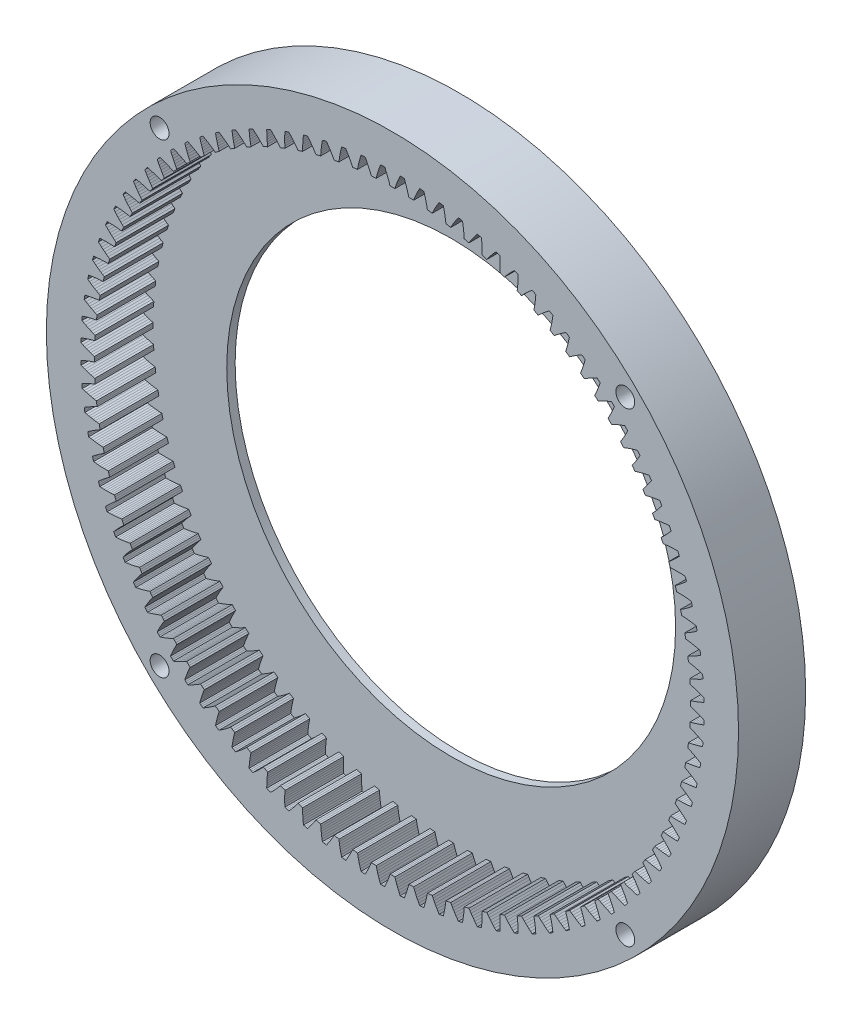
from build123d import *

# Parameters (mm, degrees)
INTERNAL_RING_TEETH_START = 30
SKETCH_1_R                = 82.5
INTERNAL_RING_TEETH_DEPTH = 14
RING_BACK_FLANGE_START    = 28
SKETCH_2_R                = 82.5
SKETCH_2_R_2              = 53.5
RING_BACK_FLANGE_DEPTH    = 2
SKETCH_3_R                = 2.25
THROUGH_HOLES_DEPTH       = 100


with BuildPart() as part:
    # Эскиз1 → Internal_ring_teeth (new body)
    with BuildSketch(Plane.XY.offset(INTERNAL_RING_TEETH_START)):
        Circle(SKETCH_1_R)
        Polygon((74.28969993, -1.840690248), (73.828419026, -1.630814793), (73.366414023, -1.430422241), (72.903744658, -1.239788746), (72.440470557, -1.059234916), (71.97665124, -0.889138112), (71.512346107, -0.729949937), (71.047614439, -0.582222073), (71.049734936, -0.194075955), (71.049734936, 0.194075955), (71.047614439, 0.582222073), (71.512346107, 0.729949937), (71.97665124, 0.889138112), (72.440470557, 1.059234916), (72.903744658, 1.239788746), (73.366414023, 1.430422241), (73.828419026, 1.630814793), (74.28969993, 1.840690248), (74.280818469, 2.169715144), (74.270479783, 2.498697476), (74.258684074, 2.827630788), (73.785135214, 3.008128035), (73.31145912, 3.179115623), (72.83773275, 3.340321696), (72.364035747, 3.491430024), (71.890451204, 3.632067724), (71.417066763, 3.761787817), (70.943976228, 3.880043431), (70.921720644, 4.267556779), (70.897348384, 4.65494276), (70.870860175, 5.042189813), (71.325398891, 5.218806913), (71.778792316, 5.406834927), (72.231015926, 5.605719539), (72.682038791, 5.815006309), (73.131825208, 6.034314882), (73.580335797, 6.263321539), (74.02752828, 6.50174692), (73.998004701, 6.82956489), (73.967029444, 7.157248878), (73.934603117, 7.484792457), (73.450655182, 7.635199155), (72.96717738, 7.77610697), (72.484263588, 7.907249415), (72.002013147, 8.028315884), (71.520532401, 8.138939448), (71.039936884, 8.238679513), (70.560354553, 8.326996177), (70.513810722, 8.712347415), (70.465162388, 9.097438632), (70.414411003, 9.482258333), (70.856962912, 9.687067641), (71.297655292, 9.903193434), (71.736498473, 10.130080948), (72.173490123, 10.367274699), (72.60861849, 10.614392839), (73.041864599, 10.871109816), (73.473203796, 11.137144168), (73.423154614, 11.462461463), (73.371665032, 11.787553889), (73.31873606, 12.11241507), (72.82629897, 12.232137632), (72.334927527, 12.342409575), (71.844732153, 12.442970833), (71.355831496, 12.533517649), (70.868354732, 12.613690497), (70.382444829, 12.683056905), (69.898263395, 12.741086072), (69.827615003, 13.122754397), (69.754882588, 13.50403107), (69.680068321, 13.884904711), (70.108886871, 14.11709794), (70.535138995, 14.360468561), (70.958869834, 14.614463556), (71.380105662, 14.878628191), (71.798858727, 15.152580637), (72.215130531, 15.43599479), (72.628914143, 15.728588196), (72.55853688, 16.050120937), (72.486736178, 16.37133881), (72.413513447, 16.692235514), (71.914530628, 16.78080145), (71.417204761, 16.860002329), (70.921662382, 16.92958553), (70.428040978, 16.989255346), (69.936492042, 17.038661072), (69.447185419, 17.077380066), (68.960315725, 17.104892722), (68.865841589, 17.481371862), (68.769312135, 17.857329266), (68.670730242, 18.232753714), (69.084123084, 18.491414502), (69.494252729, 18.761069479), (69.901198954, 19.041169552), (70.305016535, 19.331262536), (70.70574167, 19.630968121), (71.103396334, 19.939960944), (71.497991347, 20.257958672), (71.40756375, 20.574437917), (71.315735293, 20.890513537), (71.22250778, 21.206179331), (70.718948488, 21.263239111), (70.217630916, 21.311056356), (69.718697211, 21.349386887), (69.222303157, 21.377944214), (68.72862197, 21.396387836), (68.237849696, 21.40430661), (67.750213194, 21.401194175), (67.632286161, 21.770998339), (67.512340624, 22.140152743), (67.390380164, 22.508646368), (67.786715824, 22.792753899), (68.179104396, 23.087629027), (68.567659977, 23.392728752), (68.952465627, 23.707605219), (69.333581352, 24.031881143), (69.711049517, 24.365233182), (70.084898644, 24.70738024), (69.974777588, 25.01755699), (69.863283782, 25.32724295), (69.750419413, 25.636432045), (69.244270967, 25.661760482), (68.74094016, 25.67800538), (68.240584193, 25.684931967), (67.743376531, 25.682264102), (67.249511426, 25.669672832), (66.759210355, 25.646760134), (66.272731524, 25.613034892), (66.131816997, 25.974704632), (65.988928748, 26.335599151), (65.844071044, 26.695707678), (66.221785366, 27.00414071), (66.594884286, 27.323072251), (66.963515771, 27.651967538), (67.327790838, 27.990384815), (67.687793065, 28.337951309), (68.043585035, 28.694346976), (68.395212864, 29.059293066), (68.265832948, 29.361943194), (68.135113807, 29.664017306), (68.003058006, 29.965509475), (67.496317943, 29.959006608), (66.992960319, 29.943615047), (66.493156766, 29.919110356), (65.997097746, 29.885227828), (65.504997783, 29.841651357), (65.01710291, 29.787997613), (64.533701659, 29.723792661), (64.370355764, 30.075900633), (64.205088718, 30.427110981), (64.037905456, 30.777413225), (64.395507775, 31.108954514), (64.747844592, 31.450683792), (65.095097162, 31.802076641), (65.437404018, 32.16269915), (65.774871982, 32.532184528), (66.107583608, 32.910217292), (66.435602426, 33.296522138), (66.287474253, 33.590451223), (66.138045666, 33.883721338), (65.987319597, 34.176326729), (65.481987788, 34.138018222), (64.98058987, 34.091050946), (64.483311227, 34.035211684), (63.990358567, 33.970248212), (63.501965841, 33.895858517), (63.018402663, 33.811675474), (62.539986757, 33.7172442), (62.354854144, 34.058400794), (62.167860536, 34.398540905), (61.979011511, 34.737654384), (62.315090535, 35.090995487), (62.645274736, 35.454173852), (62.969777943, 35.826677477), (63.28876566, 36.208082005), (63.602367529, 36.598028077), (63.910685751, 36.996206016), (64.213801017, 37.402345049), (64.047509181, 37.686393088), (63.879960874, 37.969701802), (63.711159384, 38.252265635), (63.209230143, 38.182302674), (62.711770719, 38.103945042), (62.218979518, 38.016991581), (61.731078678, 37.921203546), (61.248320651, 37.816294209), (60.770997571, 37.701914099), (60.299455098, 37.577629181), (60.093266403, 37.906488007), (59.885284209, 38.234215504), (59.675514724, 38.560801891), (59.9887441, 38.934548332), (60.295472601, 39.317742485), (60.595945778, 39.709886785), (60.890355458, 40.110568102), (61.178853589, 40.519435929), (61.461561616, 40.936187616), (61.738577072, 41.360557992), (61.554777851, 41.633603975), (61.369771061, 41.9058332), (61.183560332, 42.177240324), (60.687014544, 42.075899022), (60.195456859, 41.966460274), (59.709097923, 41.848735781), (59.228174424, 41.722501215), (58.752956321, 41.587486265), (58.283757116, 41.443360494), (57.820949039, 41.289712426), (57.594517994, 41.604975629), (57.366368025, 41.918997121), (57.136505943, 42.231767529), (57.4256495, 42.624444303), (57.707711782, 43.026141951), (57.982969099, 43.436379311), (58.25163884, 43.854756112), (58.513894663, 44.280932079), (58.769876775, 44.714612785), (59.019699168, 45.155539708), (58.819117934, 45.416506049), (58.617382799, 45.676581419), (58.414497719, 45.935760715), (57.925295024, 45.803441018), (57.441579032, 45.663353061), (56.963571796, 45.51532214), (56.491523624, 45.359139232), (56.025720914, 45.194551512), (55.566497299, 45.021248878), (55.114250109, 44.83884404), (54.868470334, 45.13926742), (54.621052995, 45.438343607), (54.372005476, 45.736063675), (54.635922096, 46.146121065), (54.892204988, 46.564736892), (55.141160131, 46.991448292), (55.383029617, 47.425869435), (55.618008128, 47.86767162), (55.846254081, 48.316569807), (56.067897476, 48.772313138), (55.851325831, 49.020169922), (55.633658506, 49.267065038), (55.414899771, 49.512993644), (54.934970829, 49.350217759), (54.461005535, 49.180033454), (53.993236475, 49.002280316), (53.531926588, 48.81676545), (53.077377582, 48.623254512), (52.629941902, 48.421458961), (52.190040414, 48.211017222), (51.925881889, 48.495415145), (51.660173622, 48.77836571), (51.392923544, 49.059860473), (51.630571668, 49.485680169), (51.860063739, 49.91956209), (52.081734196, 50.361063495), (52.295848879, 50.809814517), (52.502622724, 51.26549933), (52.702231735, 51.7278434), (52.894821407, 52.196604531), (52.66311406, 52.43037358), (52.43037358, 52.66311406), (52.196604531, 52.894821407), (51.7278434, 52.702231735), (51.26549933, 52.502622724), (50.809814517, 52.295848879), (50.361063495, 52.081734196), (49.91956209, 51.860063739), (49.485680169, 51.630571668), (49.059860473, 51.392923544), (48.77836571, 51.660173622), (48.495415145, 51.925881889), (48.211017222, 52.190040414), (48.421458961, 52.629941902), (48.623254512, 53.077377582), (48.81676545, 53.531926588), (49.002280316, 53.993236475), (49.180033454, 54.461005535), (49.350217759, 54.934970829), (49.512993644, 55.414899771), (49.267065038, 55.633658506), (49.020169922, 55.851325831), (48.772313138, 56.067897476), (48.316569807, 55.846254081), (47.86767162, 55.618008128), (47.425869435, 55.383029617), (46.991448292, 55.141160131), (46.564736892, 54.892204988), (46.146121065, 54.635922096), (45.736063675, 54.372005476), (45.438343607, 54.621052995), (45.13926742, 54.868470334), (44.83884404, 55.114250109), (45.021248878, 55.566497299), (45.194551512, 56.025720914), (45.359139232, 56.491523624), (45.51532214, 56.963571796), (45.663353061, 57.441579032), (45.803441018, 57.925295024), (45.935760715, 58.414497719), (45.676581419, 58.617382799), (45.416506049, 58.819117934), (45.155539708, 59.019699168), (44.714612785, 58.769876775), (44.280932079, 58.513894663), (43.854756112, 58.25163884), (43.436379311, 57.982969099), (43.026141951, 57.707711782), (42.624444303, 57.4256495), (42.231767529, 57.136505943), (41.918997121, 57.366368025), (41.604975629, 57.594517994), (41.289712426, 57.820949039), (41.443360494, 58.283757116), (41.587486265, 58.752956321), (41.722501215, 59.228174424), (41.848735781, 59.709097923), (41.966460274, 60.195456859), (42.075899022, 60.687014544), (42.177240324, 61.183560332), (41.9058332, 61.369771061), (41.633603975, 61.554777851), (41.360557992, 61.738577072), (40.936187616, 61.461561616), (40.519435929, 61.178853589), (40.110568102, 60.890355458), (39.709886785, 60.595945778), (39.317742485, 60.295472601), (38.934548332, 59.9887441), (38.560801891, 59.675514724), (38.234215504, 59.885284209), (37.906488007, 60.093266403), (37.577629181, 60.299455098), (37.701914099, 60.770997571), (37.816294209, 61.248320651), (37.921203546, 61.731078678), (38.016991581, 62.218979518), (38.103945042, 62.711770719), (38.182302674, 63.209230143), (38.252265635, 63.711159384), (37.969701802, 63.879960874), (37.686393088, 64.047509181), (37.402345049, 64.213801017), (36.996206016, 63.910685751), (36.598028077, 63.602367529), (36.208082005, 63.28876566), (35.826677477, 62.969777943), (35.454173852, 62.645274736), (35.090995487, 62.315090535), (34.737654384, 61.979011511), (34.398540905, 62.167860536), (34.058400794, 62.354854144), (33.7172442, 62.539986757), (33.811675474, 63.018402663), (33.895858517, 63.501965841), (33.970248212, 63.990358567), (34.035211684, 64.483311227), (34.091050946, 64.98058987), (34.138018222, 65.481987788), (34.176326729, 65.987319597), (33.883721338, 66.138045666), (33.590451223, 66.287474253), (33.296522138, 66.435602426), (32.910217292, 66.107583608), (32.532184528, 65.774871982), (32.16269915, 65.437404018), (31.802076641, 65.095097162), (31.450683792, 64.747844592), (31.108954514, 64.395507775), (30.777413225, 64.037905456), (30.427110981, 64.205088718), (30.075900633, 64.370355764), (29.723792661, 64.533701659), (29.787997613, 65.01710291), (29.841651357, 65.504997783), (29.885227828, 65.997097746), (29.919110356, 66.493156766), (29.943615047, 66.992960319), (29.959006608, 67.496317943), (29.965509475, 68.003058006), (29.664017306, 68.135113807), (29.361943194, 68.265832948), (29.059293066, 68.395212864), (28.694346976, 68.043585035), (28.337951309, 67.687793065), (27.990384815, 67.327790838), (27.651967538, 66.963515771), (27.323072251, 66.594884286), (27.00414071, 66.221785366), (26.695707678, 65.844071044), (26.335599151, 65.988928748), (25.974704632, 66.131816997), (25.613034892, 66.272731524), (25.646760134, 66.759210355), (25.669672832, 67.249511426), (25.682264102, 67.743376531), (25.684931967, 68.240584193), (25.67800538, 68.74094016), (25.661760482, 69.244270967), (25.636432045, 69.750419413), (25.32724295, 69.863283782), (25.01755699, 69.974777588), (24.70738024, 70.084898644), (24.365233182, 69.711049517), (24.031881143, 69.333581352), (23.707605219, 68.952465627), (23.392728752, 68.567659977), (23.087629027, 68.179104396), (22.792753899, 67.786715824), (22.508646368, 67.390380164), (22.140152743, 67.512340624), (21.770998339, 67.632286161), (21.401194175, 67.750213194), (21.40430661, 68.237849696), (21.396387836, 68.72862197), (21.377944214, 69.222303157), (21.349386887, 69.718697211), (21.311056356, 70.217630916), (21.263239111, 70.718948488), (21.206179331, 71.22250778), (20.890513537, 71.315735293), (20.574437917, 71.40756375), (20.257958672, 71.497991347), (19.939960944, 71.103396334), (19.630968121, 70.70574167), (19.331262536, 70.305016535), (19.041169552, 69.901198954), (18.761069479, 69.494252729), (18.491414502, 69.084123084), (18.232753714, 68.670730242), (17.857329266, 68.769312135), (17.481371862, 68.865841589), (17.104892722, 68.960315725), (17.077380066, 69.447185419), (17.038661072, 69.936492042), (16.989255346, 70.428040978), (16.92958553, 70.921662382), (16.860002329, 71.417204761), (16.78080145, 71.914530628), (16.692235514, 72.413513447), (16.37133881, 72.486736178), (16.050120937, 72.55853688), (15.728588196, 72.628914143), (15.43599479, 72.215130531), (15.152580637, 71.798858727), (14.878628191, 71.380105662), (14.614463556, 70.958869834), (14.360468561, 70.535138995), (14.11709794, 70.108886871), (13.884904711, 69.680068321), (13.50403107, 69.754882588), (13.122754397, 69.827615003), (12.741086072, 69.898263395), (12.683056905, 70.382444829), (12.613690497, 70.868354732), (12.533517649, 71.355831496), (12.442970833, 71.844732153), (12.342409575, 72.334927527), (12.232137632, 72.82629897), (12.11241507, 73.31873606), (11.787553889, 73.371665032), (11.462461463, 73.423154614), (11.137144168, 73.473203796), (10.871109816, 73.041864599), (10.614392839, 72.60861849), (10.367274699, 72.173490123), (10.130080948, 71.736498473), (9.903193434, 71.297655292), (9.687067641, 70.856962912), (9.482258333, 70.414411003), (9.097438632, 70.465162388), (8.712347415, 70.513810722), (8.326996177, 70.560354553), (8.238679513, 71.039936884), (8.138939448, 71.520532401), (8.028315884, 72.002013147), (7.907249415, 72.484263588), (7.77610697, 72.96717738), (7.635199155, 73.450655182), (7.484792457, 73.934603117), (7.157248878, 73.967029444), (6.82956489, 73.998004701), (6.50174692, 74.02752828), (6.263321539, 73.580335797), (6.034314882, 73.131825208), (5.815006309, 72.682038791), (5.605719539, 72.231015926), (5.406834927, 71.778792316), (5.218806913, 71.325398891), (5.042189813, 70.870860175), (4.65494276, 70.897348384), (4.267556779, 70.921720644), (3.880043431, 70.943976228), (3.761787817, 71.417066763), (3.632067724, 71.890451204), (3.491430024, 72.364035747), (3.340321696, 72.83773275), (3.179115623, 73.31145912), (3.008128035, 73.785135214), (2.827630788, 74.258684074), (2.498697476, 74.270479783), (2.169715144, 74.280818469), (1.840690248, 74.28969993), (1.630814793, 73.828419026), (1.430422241, 73.366414023), (1.239788746, 72.903744658), (1.059234916, 72.440470557), (0.889138112, 71.97665124), (0.729949937, 71.512346107), (0.582222073, 71.047614439), (0.194075955, 71.049734936), (-0.194075955, 71.049734936), (-0.582222073, 71.047614439), (-0.729949937, 71.512346107), (-0.889138112, 71.97665124), (-1.059234916, 72.440470557), (-1.239788746, 72.903744658), (-1.430422241, 73.366414023), (-1.630814793, 73.828419026), (-1.840690248, 74.28969993), (-2.169715144, 74.280818469), (-2.498697476, 74.270479783), (-2.827630788, 74.258684074), (-3.008128035, 73.785135214), (-3.179115623, 73.31145912), (-3.340321696, 72.83773275), (-3.491430024, 72.364035747), (-3.632067724, 71.890451204), (-3.761787817, 71.417066763), (-3.880043431, 70.943976228), (-4.267556779, 70.921720644), (-4.65494276, 70.897348384), (-5.042189813, 70.870860175), (-5.218806913, 71.325398891), (-5.406834927, 71.778792316), (-5.605719539, 72.231015926), (-5.815006309, 72.682038791), (-6.034314882, 73.131825208), (-6.263321539, 73.580335797), (-6.50174692, 74.02752828), (-6.82956489, 73.998004701), (-7.157248878, 73.967029444), (-7.484792457, 73.934603117), (-7.635199155, 73.450655182), (-7.77610697, 72.96717738), (-7.907249415, 72.484263588), (-8.028315884, 72.002013147), (-8.138939448, 71.520532401), (-8.238679513, 71.039936884), (-8.326996177, 70.560354553), (-8.712347415, 70.513810722), (-9.097438632, 70.465162388), (-9.482258333, 70.414411003), (-9.687067641, 70.856962912), (-9.903193434, 71.297655292), (-10.130080948, 71.736498473), (-10.367274699, 72.173490123), (-10.614392839, 72.60861849), (-10.871109816, 73.041864599), (-11.137144168, 73.473203796), (-11.462461463, 73.423154614), (-11.787553889, 73.371665032), (-12.11241507, 73.31873606), (-12.232137632, 72.82629897), (-12.342409575, 72.334927527), (-12.442970833, 71.844732153), (-12.533517649, 71.355831496), (-12.613690497, 70.868354732), (-12.683056905, 70.382444829), (-12.741086072, 69.898263395), (-13.122754397, 69.827615003), (-13.50403107, 69.754882588), (-13.884904711, 69.680068321), (-14.11709794, 70.108886871), (-14.360468561, 70.535138995), (-14.614463556, 70.958869834), (-14.878628191, 71.380105662), (-15.152580637, 71.798858727), (-15.43599479, 72.215130531), (-15.728588196, 72.628914143), (-16.050120937, 72.55853688), (-16.37133881, 72.486736178), (-16.692235514, 72.413513447), (-16.78080145, 71.914530628), (-16.860002329, 71.417204761), (-16.92958553, 70.921662382), (-16.989255346, 70.428040978), (-17.038661072, 69.936492042), (-17.077380066, 69.447185419), (-17.104892722, 68.960315725), (-17.481371862, 68.865841589), (-17.857329266, 68.769312135), (-18.232753714, 68.670730242), (-18.491414502, 69.084123084), (-18.761069479, 69.494252729), (-19.041169552, 69.901198954), (-19.331262536, 70.305016535), (-19.630968121, 70.70574167), (-19.939960944, 71.103396334), (-20.257958672, 71.497991347), (-20.574437917, 71.40756375), (-20.890513537, 71.315735293), (-21.206179331, 71.22250778), (-21.263239111, 70.718948488), (-21.311056356, 70.217630916), (-21.349386887, 69.718697211), (-21.377944214, 69.222303157), (-21.396387836, 68.72862197), (-21.40430661, 68.237849696), (-21.401194175, 67.750213194), (-21.770998339, 67.632286161), (-22.140152743, 67.512340624), (-22.508646368, 67.390380164), (-22.792753899, 67.786715824), (-23.087629027, 68.179104396), (-23.392728752, 68.567659977), (-23.707605219, 68.952465627), (-24.031881143, 69.333581352), (-24.365233182, 69.711049517), (-24.70738024, 70.084898644), (-25.01755699, 69.974777588), (-25.32724295, 69.863283782), (-25.636432045, 69.750419413), (-25.661760482, 69.244270967), (-25.67800538, 68.74094016), (-25.684931967, 68.240584193), (-25.682264102, 67.743376531), (-25.669672832, 67.249511426), (-25.646760134, 66.759210355), (-25.613034892, 66.272731524), (-25.974704632, 66.131816997), (-26.335599151, 65.988928748), (-26.695707678, 65.844071044), (-27.00414071, 66.221785366), (-27.323072251, 66.594884286), (-27.651967538, 66.963515771), (-27.990384815, 67.327790838), (-28.337951309, 67.687793065), (-28.694346976, 68.043585035), (-29.059293066, 68.395212864), (-29.361943194, 68.265832948), (-29.664017306, 68.135113807), (-29.965509475, 68.003058006), (-29.959006608, 67.496317943), (-29.943615047, 66.992960319), (-29.919110356, 66.493156766), (-29.885227828, 65.997097746), (-29.841651357, 65.504997783), (-29.787997613, 65.01710291), (-29.723792661, 64.533701659), (-30.075900633, 64.370355764), (-30.427110981, 64.205088718), (-30.777413225, 64.037905456), (-31.108954514, 64.395507775), (-31.450683792, 64.747844592), (-31.802076641, 65.095097162), (-32.16269915, 65.437404018), (-32.532184528, 65.774871982), (-32.910217292, 66.107583608), (-33.296522138, 66.435602426), (-33.590451223, 66.287474253), (-33.883721338, 66.138045666), (-34.176326729, 65.987319597), (-34.138018222, 65.481987788), (-34.091050946, 64.98058987), (-34.035211684, 64.483311227), (-33.970248212, 63.990358567), (-33.895858517, 63.501965841), (-33.811675474, 63.018402663), (-33.7172442, 62.539986757), (-34.058400794, 62.354854144), (-34.398540905, 62.167860536), (-34.737654384, 61.979011511), (-35.090995487, 62.315090535), (-35.454173852, 62.645274736), (-35.826677477, 62.969777943), (-36.208082005, 63.28876566), (-36.598028077, 63.602367529), (-36.996206016, 63.910685751), (-37.402345049, 64.213801017), (-37.686393088, 64.047509181), (-37.969701802, 63.879960874), (-38.252265635, 63.711159384), (-38.182302674, 63.209230143), (-38.103945042, 62.711770719), (-38.016991581, 62.218979518), (-37.921203546, 61.731078678), (-37.816294209, 61.248320651), (-37.701914099, 60.770997571), (-37.577629181, 60.299455098), (-37.906488007, 60.093266403), (-38.234215504, 59.885284209), (-38.560801891, 59.675514724), (-38.934548332, 59.9887441), (-39.317742485, 60.295472601), (-39.709886785, 60.595945778), (-40.110568102, 60.890355458), (-40.519435929, 61.178853589), (-40.936187616, 61.461561616), (-41.360557992, 61.738577072), (-41.633603975, 61.554777851), (-41.9058332, 61.369771061), (-42.177240324, 61.183560332), (-42.075899022, 60.687014544), (-41.966460274, 60.195456859), (-41.848735781, 59.709097923), (-41.722501215, 59.228174424), (-41.587486265, 58.752956321), (-41.443360494, 58.283757116), (-41.289712426, 57.820949039), (-41.604975629, 57.594517994), (-41.918997121, 57.366368025), (-42.231767529, 57.136505943), (-42.624444303, 57.4256495), (-43.026141951, 57.707711782), (-43.436379311, 57.982969099), (-43.854756112, 58.25163884), (-44.280932079, 58.513894663), (-44.714612785, 58.769876775), (-45.155539708, 59.019699168), (-45.416506049, 58.819117934), (-45.676581419, 58.617382799), (-45.935760715, 58.414497719), (-45.803441018, 57.925295024), (-45.663353061, 57.441579032), (-45.51532214, 56.963571796), (-45.359139232, 56.491523624), (-45.194551512, 56.025720914), (-45.021248878, 55.566497299), (-44.83884404, 55.114250109), (-45.13926742, 54.868470334), (-45.438343607, 54.621052995), (-45.736063675, 54.372005476), (-46.146121065, 54.635922096), (-46.564736892, 54.892204988), (-46.991448292, 55.141160131), (-47.425869435, 55.383029617), (-47.86767162, 55.618008128), (-48.316569807, 55.846254081), (-48.772313138, 56.067897476), (-49.020169922, 55.851325831), (-49.267065038, 55.633658506), (-49.512993644, 55.414899771), (-49.350217759, 54.934970829), (-49.180033454, 54.461005535), (-49.002280316, 53.993236475), (-48.81676545, 53.531926588), (-48.623254512, 53.077377582), (-48.421458961, 52.629941902), (-48.211017222, 52.190040414), (-48.495415145, 51.925881889), (-48.77836571, 51.660173622), (-49.059860473, 51.392923544), (-49.485680169, 51.630571668), (-49.91956209, 51.860063739), (-50.361063495, 52.081734196), (-50.809814517, 52.295848879), (-51.26549933, 52.502622724), (-51.7278434, 52.702231735), (-52.196604531, 52.894821407), (-52.43037358, 52.66311406), (-52.66311406, 52.43037358), (-52.894821407, 52.196604531), (-52.702231735, 51.7278434), (-52.502622724, 51.26549933), (-52.295848879, 50.809814517), (-52.081734196, 50.361063495), (-51.860063739, 49.91956209), (-51.630571668, 49.485680169), (-51.392923544, 49.059860473), (-51.660173622, 48.77836571), (-51.925881889, 48.495415145), (-52.190040414, 48.211017222), (-52.629941902, 48.421458961), (-53.077377582, 48.623254512), (-53.531926588, 48.81676545), (-53.993236475, 49.002280316), (-54.461005535, 49.180033454), (-54.934970829, 49.350217759), (-55.414899771, 49.512993644), (-55.633658506, 49.267065038), (-55.851325831, 49.020169922), (-56.067897476, 48.772313138), (-55.846254081, 48.316569807), (-55.618008128, 47.86767162), (-55.383029617, 47.425869435), (-55.141160131, 46.991448292), (-54.892204988, 46.564736892), (-54.635922096, 46.146121065), (-54.372005476, 45.736063675), (-54.621052995, 45.438343607), (-54.868470334, 45.13926742), (-55.114250109, 44.83884404), (-55.566497299, 45.021248878), (-56.025720914, 45.194551512), (-56.491523624, 45.359139232), (-56.963571796, 45.51532214), (-57.441579032, 45.663353061), (-57.925295024, 45.803441018), (-58.414497719, 45.935760715), (-58.617382799, 45.676581419), (-58.819117934, 45.416506049), (-59.019699168, 45.155539708), (-58.769876775, 44.714612785), (-58.513894663, 44.280932079), (-58.25163884, 43.854756112), (-57.982969099, 43.436379311), (-57.707711782, 43.026141951), (-57.4256495, 42.624444303), (-57.136505943, 42.231767529), (-57.366368025, 41.918997121), (-57.594517994, 41.604975629), (-57.820949039, 41.289712426), (-58.283757116, 41.443360494), (-58.752956321, 41.587486265), (-59.228174424, 41.722501215), (-59.709097923, 41.848735781), (-60.195456859, 41.966460274), (-60.687014544, 42.075899022), (-61.183560332, 42.177240324), (-61.369771061, 41.9058332), (-61.554777851, 41.633603975), (-61.738577072, 41.360557992), (-61.461561616, 40.936187616), (-61.178853589, 40.519435929), (-60.890355458, 40.110568102), (-60.595945778, 39.709886785), (-60.295472601, 39.317742485), (-59.9887441, 38.934548332), (-59.675514724, 38.560801891), (-59.885284209, 38.234215504), (-60.093266403, 37.906488007), (-60.299455098, 37.577629181), (-60.770997571, 37.701914099), (-61.248320651, 37.816294209), (-61.731078678, 37.921203546), (-62.218979518, 38.016991581), (-62.711770719, 38.103945042), (-63.209230143, 38.182302674), (-63.711159384, 38.252265635), (-63.879960874, 37.969701802), (-64.047509181, 37.686393088), (-64.213801017, 37.402345049), (-63.910685751, 36.996206016), (-63.602367529, 36.598028077), (-63.28876566, 36.208082005), (-62.969777943, 35.826677477), (-62.645274736, 35.454173852), (-62.315090535, 35.090995487), (-61.979011511, 34.737654384), (-62.167860536, 34.398540905), (-62.354854144, 34.058400794), (-62.539986757, 33.7172442), (-63.018402663, 33.811675474), (-63.501965841, 33.895858517), (-63.990358567, 33.970248212), (-64.483311227, 34.035211684), (-64.98058987, 34.091050946), (-65.481987788, 34.138018222), (-65.987319597, 34.176326729), (-66.138045666, 33.883721338), (-66.287474253, 33.590451223), (-66.435602426, 33.296522138), (-66.107583608, 32.910217292), (-65.774871982, 32.532184528), (-65.437404018, 32.16269915), (-65.095097162, 31.802076641), (-64.747844592, 31.450683792), (-64.395507775, 31.108954514), (-64.037905456, 30.777413225), (-64.205088718, 30.427110981), (-64.370355764, 30.075900633), (-64.533701659, 29.723792661), (-65.01710291, 29.787997613), (-65.504997783, 29.841651357), (-65.997097746, 29.885227828), (-66.493156766, 29.919110356), (-66.992960319, 29.943615047), (-67.496317943, 29.959006608), (-68.003058006, 29.965509475), (-68.135113807, 29.664017306), (-68.265832948, 29.361943194), (-68.395212864, 29.059293066), (-68.043585035, 28.694346976), (-67.687793065, 28.337951309), (-67.327790838, 27.990384815), (-66.963515771, 27.651967538), (-66.594884286, 27.323072251), (-66.221785366, 27.00414071), (-65.844071044, 26.695707678), (-65.988928748, 26.335599151), (-66.131816997, 25.974704632), (-66.272731524, 25.613034892), (-66.759210355, 25.646760134), (-67.249511426, 25.669672832), (-67.743376531, 25.682264102), (-68.240584193, 25.684931967), (-68.74094016, 25.67800538), (-69.244270967, 25.661760482), (-69.750419413, 25.636432045), (-69.863283782, 25.32724295), (-69.974777588, 25.01755699), (-70.084898644, 24.70738024), (-69.711049517, 24.365233182), (-69.333581352, 24.031881143), (-68.952465627, 23.707605219), (-68.567659977, 23.392728752), (-68.179104396, 23.087629027), (-67.786715824, 22.792753899), (-67.390380164, 22.508646368), (-67.512340624, 22.140152743), (-67.632286161, 21.770998339), (-67.750213194, 21.401194175), (-68.237849696, 21.40430661), (-68.72862197, 21.396387836), (-69.222303157, 21.377944214), (-69.718697211, 21.349386887), (-70.217630916, 21.311056356), (-70.718948488, 21.263239111), (-71.22250778, 21.206179331), (-71.315735293, 20.890513537), (-71.40756375, 20.574437917), (-71.497991347, 20.257958672), (-71.103396334, 19.939960944), (-70.70574167, 19.630968121), (-70.305016535, 19.331262536), (-69.901198954, 19.041169552), (-69.494252729, 18.761069479), (-69.084123084, 18.491414502), (-68.670730242, 18.232753714), (-68.769312135, 17.857329266), (-68.865841589, 17.481371862), (-68.960315725, 17.104892722), (-69.447185419, 17.077380066), (-69.936492042, 17.038661072), (-70.428040978, 16.989255346), (-70.921662382, 16.92958553), (-71.417204761, 16.860002329), (-71.914530628, 16.78080145), (-72.413513447, 16.692235514), (-72.486736178, 16.37133881), (-72.55853688, 16.050120937), (-72.628914143, 15.728588196), (-72.215130531, 15.43599479), (-71.798858727, 15.152580637), (-71.380105662, 14.878628191), (-70.958869834, 14.614463556), (-70.535138995, 14.360468561), (-70.108886871, 14.11709794), (-69.680068321, 13.884904711), (-69.754882588, 13.50403107), (-69.827615003, 13.122754397), (-69.898263395, 12.741086072), (-70.382444829, 12.683056905), (-70.868354732, 12.613690497), (-71.355831496, 12.533517649), (-71.844732153, 12.442970833), (-72.334927527, 12.342409575), (-72.82629897, 12.232137632), (-73.31873606, 12.11241507), (-73.371665032, 11.787553889), (-73.423154614, 11.462461463), (-73.473203796, 11.137144168), (-73.041864599, 10.871109816), (-72.60861849, 10.614392839), (-72.173490123, 10.367274699), (-71.736498473, 10.130080948), (-71.297655292, 9.903193434), (-70.856962912, 9.687067641), (-70.414411003, 9.482258333), (-70.465162388, 9.097438632), (-70.513810722, 8.712347415), (-70.560354553, 8.326996177), (-71.039936884, 8.238679513), (-71.520532401, 8.138939448), (-72.002013147, 8.028315884), (-72.484263588, 7.907249415), (-72.96717738, 7.77610697), (-73.450655182, 7.635199155), (-73.934603117, 7.484792457), (-73.967029444, 7.157248878), (-73.998004701, 6.82956489), (-74.02752828, 6.50174692), (-73.580335797, 6.263321539), (-73.131825208, 6.034314882), (-72.682038791, 5.815006309), (-72.231015926, 5.605719539), (-71.778792316, 5.406834927), (-71.325398891, 5.218806913), (-70.870860175, 5.042189813), (-70.897348384, 4.65494276), (-70.921720644, 4.267556779), (-70.943976228, 3.880043431), (-71.417066763, 3.761787817), (-71.890451204, 3.632067724), (-72.364035747, 3.491430024), (-72.83773275, 3.340321696), (-73.31145912, 3.179115623), (-73.785135214, 3.008128035), (-74.258684074, 2.827630788), (-74.270479783, 2.498697476), (-74.280818469, 2.169715144), (-74.28969993, 1.840690248), (-73.828419026, 1.630814793), (-73.366414023, 1.430422241), (-72.903744658, 1.239788746), (-72.440470557, 1.059234916), (-71.97665124, 0.889138112), (-71.512346107, 0.729949937), (-71.047614439, 0.582222073), (-71.049734936, 0.194075955), (-71.049734936, -0.194075955), (-71.047614439, -0.582222073), (-71.512346107, -0.729949937), (-71.97665124, -0.889138112), (-72.440470557, -1.059234916), (-72.903744658, -1.239788746), (-73.366414023, -1.430422241), (-73.828419026, -1.630814793), (-74.28969993, -1.840690248), (-74.280818469, -2.169715144), (-74.270479783, -2.498697476), (-74.258684074, -2.827630788), (-73.785135214, -3.008128035), (-73.31145912, -3.179115623), (-72.83773275, -3.340321696), (-72.364035747, -3.491430024), (-71.890451204, -3.632067724), (-71.417066763, -3.761787817), (-70.943976228, -3.880043431), (-70.921720644, -4.267556779), (-70.897348384, -4.65494276), (-70.870860175, -5.042189813), (-71.325398891, -5.218806913), (-71.778792316, -5.406834927), (-72.231015926, -5.605719539), (-72.682038791, -5.815006309), (-73.131825208, -6.034314882), (-73.580335797, -6.263321539), (-74.02752828, -6.50174692), (-73.998004701, -6.82956489), (-73.967029444, -7.157248878), (-73.934603117, -7.484792457), (-73.450655182, -7.635199155), (-72.96717738, -7.77610697), (-72.484263588, -7.907249415), (-72.002013147, -8.028315884), (-71.520532401, -8.138939448), (-71.039936884, -8.238679513), (-70.560354553, -8.326996177), (-70.513810722, -8.712347415), (-70.465162388, -9.097438632), (-70.414411003, -9.482258333), (-70.856962912, -9.687067641), (-71.297655292, -9.903193434), (-71.736498473, -10.130080948), (-72.173490123, -10.367274699), (-72.60861849, -10.614392839), (-73.041864599, -10.871109816), (-73.473203796, -11.137144168), (-73.423154614, -11.462461463), (-73.371665032, -11.787553889), (-73.31873606, -12.11241507), (-72.82629897, -12.232137632), (-72.334927527, -12.342409575), (-71.844732153, -12.442970833), (-71.355831496, -12.533517649), (-70.868354732, -12.613690497), (-70.382444829, -12.683056905), (-69.898263395, -12.741086072), (-69.827615003, -13.122754397), (-69.754882588, -13.50403107), (-69.680068321, -13.884904711), (-70.108886871, -14.11709794), (-70.535138995, -14.360468561), (-70.958869834, -14.614463556), (-71.380105662, -14.878628191), (-71.798858727, -15.152580637), (-72.215130531, -15.43599479), (-72.628914143, -15.728588196), (-72.55853688, -16.050120937), (-72.486736178, -16.37133881), (-72.413513447, -16.692235514), (-71.914530628, -16.78080145), (-71.417204761, -16.860002329), (-70.921662382, -16.92958553), (-70.428040978, -16.989255346), (-69.936492042, -17.038661072), (-69.447185419, -17.077380066), (-68.960315725, -17.104892722), (-68.865841589, -17.481371862), (-68.769312135, -17.857329266), (-68.670730242, -18.232753714), (-69.084123084, -18.491414502), (-69.494252729, -18.761069479), (-69.901198954, -19.041169552), (-70.305016535, -19.331262536), (-70.70574167, -19.630968121), (-71.103396334, -19.939960944), (-71.497991347, -20.257958672), (-71.40756375, -20.574437917), (-71.315735293, -20.890513537), (-71.22250778, -21.206179331), (-70.718948488, -21.263239111), (-70.217630916, -21.311056356), (-69.718697211, -21.349386887), (-69.222303157, -21.377944214), (-68.72862197, -21.396387836), (-68.237849696, -21.40430661), (-67.750213194, -21.401194175), (-67.632286161, -21.770998339), (-67.512340624, -22.140152743), (-67.390380164, -22.508646368), (-67.786715824, -22.792753899), (-68.179104396, -23.087629027), (-68.567659977, -23.392728752), (-68.952465627, -23.707605219), (-69.333581352, -24.031881143), (-69.711049517, -24.365233182), (-70.084898644, -24.70738024), (-69.974777588, -25.01755699), (-69.863283782, -25.32724295), (-69.750419413, -25.636432045), (-69.244270967, -25.661760482), (-68.74094016, -25.67800538), (-68.240584193, -25.684931967), (-67.743376531, -25.682264102), (-67.249511426, -25.669672832), (-66.759210355, -25.646760134), (-66.272731524, -25.613034892), (-66.131816997, -25.974704632), (-65.988928748, -26.335599151), (-65.844071044, -26.695707678), (-66.221785366, -27.00414071), (-66.594884286, -27.323072251), (-66.963515771, -27.651967538), (-67.327790838, -27.990384815), (-67.687793065, -28.337951309), (-68.043585035, -28.694346976), (-68.395212864, -29.059293066), (-68.265832948, -29.361943194), (-68.135113807, -29.664017306), (-68.003058006, -29.965509475), (-67.496317943, -29.959006608), (-66.992960319, -29.943615047), (-66.493156766, -29.919110356), (-65.997097746, -29.885227828), (-65.504997783, -29.841651357), (-65.01710291, -29.787997613), (-64.533701659, -29.723792661), (-64.370355764, -30.075900633), (-64.205088718, -30.427110981), (-64.037905456, -30.777413225), (-64.395507775, -31.108954514), (-64.747844592, -31.450683792), (-65.095097162, -31.802076641), (-65.437404018, -32.16269915), (-65.774871982, -32.532184528), (-66.107583608, -32.910217292), (-66.435602426, -33.296522138), (-66.287474253, -33.590451223), (-66.138045666, -33.883721338), (-65.987319597, -34.176326729), (-65.481987788, -34.138018222), (-64.98058987, -34.091050946), (-64.483311227, -34.035211684), (-63.990358567, -33.970248212), (-63.501965841, -33.895858517), (-63.018402663, -33.811675474), (-62.539986757, -33.7172442), (-62.354854144, -34.058400794), (-62.167860536, -34.398540905), (-61.979011511, -34.737654384), (-62.315090535, -35.090995487), (-62.645274736, -35.454173852), (-62.969777943, -35.826677477), (-63.28876566, -36.208082005), (-63.602367529, -36.598028077), (-63.910685751, -36.996206016), (-64.213801017, -37.402345049), (-64.047509181, -37.686393088), (-63.879960874, -37.969701802), (-63.711159384, -38.252265635), (-63.209230143, -38.182302674), (-62.711770719, -38.103945042), (-62.218979518, -38.016991581), (-61.731078678, -37.921203546), (-61.248320651, -37.816294209), (-60.770997571, -37.701914099), (-60.299455098, -37.577629181), (-60.093266403, -37.906488007), (-59.885284209, -38.234215504), (-59.675514724, -38.560801891), (-59.9887441, -38.934548332), (-60.295472601, -39.317742485), (-60.595945778, -39.709886785), (-60.890355458, -40.110568102), (-61.178853589, -40.519435929), (-61.461561616, -40.936187616), (-61.738577072, -41.360557992), (-61.554777851, -41.633603975), (-61.369771061, -41.9058332), (-61.183560332, -42.177240324), (-60.687014544, -42.075899022), (-60.195456859, -41.966460274), (-59.709097923, -41.848735781), (-59.228174424, -41.722501215), (-58.752956321, -41.587486265), (-58.283757116, -41.443360494), (-57.820949039, -41.289712426), (-57.594517994, -41.604975629), (-57.366368025, -41.918997121), (-57.136505943, -42.231767529), (-57.4256495, -42.624444303), (-57.707711782, -43.026141951), (-57.982969099, -43.436379311), (-58.25163884, -43.854756112), (-58.513894663, -44.280932079), (-58.769876775, -44.714612785), (-59.019699168, -45.155539708), (-58.819117934, -45.416506049), (-58.617382799, -45.676581419), (-58.414497719, -45.935760715), (-57.925295024, -45.803441018), (-57.441579032, -45.663353061), (-56.963571796, -45.51532214), (-56.491523624, -45.359139232), (-56.025720914, -45.194551512), (-55.566497299, -45.021248878), (-55.114250109, -44.83884404), (-54.868470334, -45.13926742), (-54.621052995, -45.438343607), (-54.372005476, -45.736063675), (-54.635922096, -46.146121065), (-54.892204988, -46.564736892), (-55.141160131, -46.991448292), (-55.383029617, -47.425869435), (-55.618008128, -47.86767162), (-55.846254081, -48.316569807), (-56.067897476, -48.772313138), (-55.851325831, -49.020169922), (-55.633658506, -49.267065038), (-55.414899771, -49.512993644), (-54.934970829, -49.350217759), (-54.461005535, -49.180033454), (-53.993236475, -49.002280316), (-53.531926588, -48.81676545), (-53.077377582, -48.623254512), (-52.629941902, -48.421458961), (-52.190040414, -48.211017222), (-51.925881889, -48.495415145), (-51.660173622, -48.77836571), (-51.392923544, -49.059860473), (-51.630571668, -49.485680169), (-51.860063739, -49.91956209), (-52.081734196, -50.361063495), (-52.295848879, -50.809814517), (-52.502622724, -51.26549933), (-52.702231735, -51.7278434), (-52.894821407, -52.196604531), (-52.66311406, -52.43037358), (-52.43037358, -52.66311406), (-52.196604531, -52.894821407), (-51.7278434, -52.702231735), (-51.26549933, -52.502622724), (-50.809814517, -52.295848879), (-50.361063495, -52.081734196), (-49.91956209, -51.860063739), (-49.485680169, -51.630571668), (-49.059860473, -51.392923544), (-48.77836571, -51.660173622), (-48.495415145, -51.925881889), (-48.211017222, -52.190040414), (-48.421458961, -52.629941902), (-48.623254512, -53.077377582), (-48.81676545, -53.531926588), (-49.002280316, -53.993236475), (-49.180033454, -54.461005535), (-49.350217759, -54.934970829), (-49.512993644, -55.414899771), (-49.267065038, -55.633658506), (-49.020169922, -55.851325831), (-48.772313138, -56.067897476), (-48.316569807, -55.846254081), (-47.86767162, -55.618008128), (-47.425869435, -55.383029617), (-46.991448292, -55.141160131), (-46.564736892, -54.892204988), (-46.146121065, -54.635922096), (-45.736063675, -54.372005476), (-45.438343607, -54.621052995), (-45.13926742, -54.868470334), (-44.83884404, -55.114250109), (-45.021248878, -55.566497299), (-45.194551512, -56.025720914), (-45.359139232, -56.491523624), (-45.51532214, -56.963571796), (-45.663353061, -57.441579032), (-45.803441018, -57.925295024), (-45.935760715, -58.414497719), (-45.676581419, -58.617382799), (-45.416506049, -58.819117934), (-45.155539708, -59.019699168), (-44.714612785, -58.769876775), (-44.280932079, -58.513894663), (-43.854756112, -58.25163884), (-43.436379311, -57.982969099), (-43.026141951, -57.707711782), (-42.624444303, -57.4256495), (-42.231767529, -57.136505943), (-41.918997121, -57.366368025), (-41.604975629, -57.594517994), (-41.289712426, -57.820949039), (-41.443360494, -58.283757116), (-41.587486265, -58.752956321), (-41.722501215, -59.228174424), (-41.848735781, -59.709097923), (-41.966460274, -60.195456859), (-42.075899022, -60.687014544), (-42.177240324, -61.183560332), (-41.9058332, -61.369771061), (-41.633603975, -61.554777851), (-41.360557992, -61.738577072), (-40.936187616, -61.461561616), (-40.519435929, -61.178853589), (-40.110568102, -60.890355458), (-39.709886785, -60.595945778), (-39.317742485, -60.295472601), (-38.934548332, -59.9887441), (-38.560801891, -59.675514724), (-38.234215504, -59.885284209), (-37.906488007, -60.093266403), (-37.577629181, -60.299455098), (-37.701914099, -60.770997571), (-37.816294209, -61.248320651), (-37.921203546, -61.731078678), (-38.016991581, -62.218979518), (-38.103945042, -62.711770719), (-38.182302674, -63.209230143), (-38.252265635, -63.711159384), (-37.969701802, -63.879960874), (-37.686393088, -64.047509181), (-37.402345049, -64.213801017), (-36.996206016, -63.910685751), (-36.598028077, -63.602367529), (-36.208082005, -63.28876566), (-35.826677477, -62.969777943), (-35.454173852, -62.645274736), (-35.090995487, -62.315090535), (-34.737654384, -61.979011511), (-34.398540905, -62.167860536), (-34.058400794, -62.354854144), (-33.7172442, -62.539986757), (-33.811675474, -63.018402663), (-33.895858517, -63.501965841), (-33.970248212, -63.990358567), (-34.035211684, -64.483311227), (-34.091050946, -64.98058987), (-34.138018222, -65.481987788), (-34.176326729, -65.987319597), (-33.883721338, -66.138045666), (-33.590451223, -66.287474253), (-33.296522138, -66.435602426), (-32.910217292, -66.107583608), (-32.532184528, -65.774871982), (-32.16269915, -65.437404018), (-31.802076641, -65.095097162), (-31.450683792, -64.747844592), (-31.108954514, -64.395507775), (-30.777413225, -64.037905456), (-30.427110981, -64.205088718), (-30.075900633, -64.370355764), (-29.723792661, -64.533701659), (-29.787997613, -65.01710291), (-29.841651357, -65.504997783), (-29.885227828, -65.997097746), (-29.919110356, -66.493156766), (-29.943615047, -66.992960319), (-29.959006608, -67.496317943), (-29.965509475, -68.003058006), (-29.664017306, -68.135113807), (-29.361943194, -68.265832948), (-29.059293066, -68.395212864), (-28.694346976, -68.043585035), (-28.337951309, -67.687793065), (-27.990384815, -67.327790838), (-27.651967538, -66.963515771), (-27.323072251, -66.594884286), (-27.00414071, -66.221785366), (-26.695707678, -65.844071044), (-26.335599151, -65.988928748), (-25.974704632, -66.131816997), (-25.613034892, -66.272731524), (-25.646760134, -66.759210355), (-25.669672832, -67.249511426), (-25.682264102, -67.743376531), (-25.684931967, -68.240584193), (-25.67800538, -68.74094016), (-25.661760482, -69.244270967), (-25.636432045, -69.750419413), (-25.32724295, -69.863283782), (-25.01755699, -69.974777588), (-24.70738024, -70.084898644), (-24.365233182, -69.711049517), (-24.031881143, -69.333581352), (-23.707605219, -68.952465627), (-23.392728752, -68.567659977), (-23.087629027, -68.179104396), (-22.792753899, -67.786715824), (-22.508646368, -67.390380164), (-22.140152743, -67.512340624), (-21.770998339, -67.632286161), (-21.401194175, -67.750213194), (-21.40430661, -68.237849696), (-21.396387836, -68.72862197), (-21.377944214, -69.222303157), (-21.349386887, -69.718697211), (-21.311056356, -70.217630916), (-21.263239111, -70.718948488), (-21.206179331, -71.22250778), (-20.890513537, -71.315735293), (-20.574437917, -71.40756375), (-20.257958672, -71.497991347), (-19.939960944, -71.103396334), (-19.630968121, -70.70574167), (-19.331262536, -70.305016535), (-19.041169552, -69.901198954), (-18.761069479, -69.494252729), (-18.491414502, -69.084123084), (-18.232753714, -68.670730242), (-17.857329266, -68.769312135), (-17.481371862, -68.865841589), (-17.104892722, -68.960315725), (-17.077380066, -69.447185419), (-17.038661072, -69.936492042), (-16.989255346, -70.428040978), (-16.92958553, -70.921662382), (-16.860002329, -71.417204761), (-16.78080145, -71.914530628), (-16.692235514, -72.413513447), (-16.37133881, -72.486736178), (-16.050120937, -72.55853688), (-15.728588196, -72.628914143), (-15.43599479, -72.215130531), (-15.152580637, -71.798858727), (-14.878628191, -71.380105662), (-14.614463556, -70.958869834), (-14.360468561, -70.535138995), (-14.11709794, -70.108886871), (-13.884904711, -69.680068321), (-13.50403107, -69.754882588), (-13.122754397, -69.827615003), (-12.741086072, -69.898263395), (-12.683056905, -70.382444829), (-12.613690497, -70.868354732), (-12.533517649, -71.355831496), (-12.442970833, -71.844732153), (-12.342409575, -72.334927527), (-12.232137632, -72.82629897), (-12.11241507, -73.31873606), (-11.787553889, -73.371665032), (-11.462461463, -73.423154614), (-11.137144168, -73.473203796), (-10.871109816, -73.041864599), (-10.614392839, -72.60861849), (-10.367274699, -72.173490123), (-10.130080948, -71.736498473), (-9.903193434, -71.297655292), (-9.687067641, -70.856962912), (-9.482258333, -70.414411003), (-9.097438632, -70.465162388), (-8.712347415, -70.513810722), (-8.326996177, -70.560354553), (-8.238679513, -71.039936884), (-8.138939448, -71.520532401), (-8.028315884, -72.002013147), (-7.907249415, -72.484263588), (-7.77610697, -72.96717738), (-7.635199155, -73.450655182), (-7.484792457, -73.934603117), (-7.157248878, -73.967029444), (-6.82956489, -73.998004701), (-6.50174692, -74.02752828), (-6.263321539, -73.580335797), (-6.034314882, -73.131825208), (-5.815006309, -72.682038791), (-5.605719539, -72.231015926), (-5.406834927, -71.778792316), (-5.218806913, -71.325398891), (-5.042189813, -70.870860175), (-4.65494276, -70.897348384), (-4.267556779, -70.921720644), (-3.880043431, -70.943976228), (-3.761787817, -71.417066763), (-3.632067724, -71.890451204), (-3.491430024, -72.364035747), (-3.340321696, -72.83773275), (-3.179115623, -73.31145912), (-3.008128035, -73.785135214), (-2.827630788, -74.258684074), (-2.498697476, -74.270479783), (-2.169715144, -74.280818469), (-1.840690248, -74.28969993), (-1.630814793, -73.828419026), (-1.430422241, -73.366414023), (-1.239788746, -72.903744658), (-1.059234916, -72.440470557), (-0.889138112, -71.97665124), (-0.729949937, -71.512346107), (-0.582222073, -71.047614439), (-0.194075955, -71.049734936), (0.194075955, -71.049734936), (0.582222073, -71.047614439), (0.729949937, -71.512346107), (0.889138112, -71.97665124), (1.059234916, -72.440470557), (1.239788746, -72.903744658), (1.430422241, -73.366414023), (1.630814793, -73.828419026), (1.840690248, -74.28969993), (2.169715144, -74.280818469), (2.498697476, -74.270479783), (2.827630788, -74.258684074), (3.008128035, -73.785135214), (3.179115623, -73.31145912), (3.340321696, -72.83773275), (3.491430024, -72.364035747), (3.632067724, -71.890451204), (3.761787817, -71.417066763), (3.880043431, -70.943976228), (4.267556779, -70.921720644), (4.65494276, -70.897348384), (5.042189813, -70.870860175), (5.218806913, -71.325398891), (5.406834927, -71.778792316), (5.605719539, -72.231015926), (5.815006309, -72.682038791), (6.034314882, -73.131825208), (6.263321539, -73.580335797), (6.50174692, -74.02752828), (6.82956489, -73.998004701), (7.157248878, -73.967029444), (7.484792457, -73.934603117), (7.635199155, -73.450655182), (7.77610697, -72.96717738), (7.907249415, -72.484263588), (8.028315884, -72.002013147), (8.138939448, -71.520532401), (8.238679513, -71.039936884), (8.326996177, -70.560354553), (8.712347415, -70.513810722), (9.097438632, -70.465162388), (9.482258333, -70.414411003), (9.687067641, -70.856962912), (9.903193434, -71.297655292), (10.130080948, -71.736498473), (10.367274699, -72.173490123), (10.614392839, -72.60861849), (10.871109816, -73.041864599), (11.137144168, -73.473203796), (11.462461463, -73.423154614), (11.787553889, -73.371665032), (12.11241507, -73.31873606), (12.232137632, -72.82629897), (12.342409575, -72.334927527), (12.442970833, -71.844732153), (12.533517649, -71.355831496), (12.613690497, -70.868354732), (12.683056905, -70.382444829), (12.741086072, -69.898263395), (13.122754397, -69.827615003), (13.50403107, -69.754882588), (13.884904711, -69.680068321), (14.11709794, -70.108886871), (14.360468561, -70.535138995), (14.614463556, -70.958869834), (14.878628191, -71.380105662), (15.152580637, -71.798858727), (15.43599479, -72.215130531), (15.728588196, -72.628914143), (16.050120937, -72.55853688), (16.37133881, -72.486736178), (16.692235514, -72.413513447), (16.78080145, -71.914530628), (16.860002329, -71.417204761), (16.92958553, -70.921662382), (16.989255346, -70.428040978), (17.038661072, -69.936492042), (17.077380066, -69.447185419), (17.104892722, -68.960315725), (17.481371862, -68.865841589), (17.857329266, -68.769312135), (18.232753714, -68.670730242), (18.491414502, -69.084123084), (18.761069479, -69.494252729), (19.041169552, -69.901198954), (19.331262536, -70.305016535), (19.630968121, -70.70574167), (19.939960944, -71.103396334), (20.257958672, -71.497991347), (20.574437917, -71.40756375), (20.890513537, -71.315735293), (21.206179331, -71.22250778), (21.263239111, -70.718948488), (21.311056356, -70.217630916), (21.349386887, -69.718697211), (21.377944214, -69.222303157), (21.396387836, -68.72862197), (21.40430661, -68.237849696), (21.401194175, -67.750213194), (21.770998339, -67.632286161), (22.140152743, -67.512340624), (22.508646368, -67.390380164), (22.792753899, -67.786715824), (23.087629027, -68.179104396), (23.392728752, -68.567659977), (23.707605219, -68.952465627), (24.031881143, -69.333581352), (24.365233182, -69.711049517), (24.70738024, -70.084898644), (25.01755699, -69.974777588), (25.32724295, -69.863283782), (25.636432045, -69.750419413), (25.661760482, -69.244270967), (25.67800538, -68.74094016), (25.684931967, -68.240584193), (25.682264102, -67.743376531), (25.669672832, -67.249511426), (25.646760134, -66.759210355), (25.613034892, -66.272731524), (25.974704632, -66.131816997), (26.335599151, -65.988928748), (26.695707678, -65.844071044), (27.00414071, -66.221785366), (27.323072251, -66.594884286), (27.651967538, -66.963515771), (27.990384815, -67.327790838), (28.337951309, -67.687793065), (28.694346976, -68.043585035), (29.059293066, -68.395212864), (29.361943194, -68.265832948), (29.664017306, -68.135113807), (29.965509475, -68.003058006), (29.959006608, -67.496317943), (29.943615047, -66.992960319), (29.919110356, -66.493156766), (29.885227828, -65.997097746), (29.841651357, -65.504997783), (29.787997613, -65.01710291), (29.723792661, -64.533701659), (30.075900633, -64.370355764), (30.427110981, -64.205088718), (30.777413225, -64.037905456), (31.108954514, -64.395507775), (31.450683792, -64.747844592), (31.802076641, -65.095097162), (32.16269915, -65.437404018), (32.532184528, -65.774871982), (32.910217292, -66.107583608), (33.296522138, -66.435602426), (33.590451223, -66.287474253), (33.883721338, -66.138045666), (34.176326729, -65.987319597), (34.138018222, -65.481987788), (34.091050946, -64.98058987), (34.035211684, -64.483311227), (33.970248212, -63.990358567), (33.895858517, -63.501965841), (33.811675474, -63.018402663), (33.7172442, -62.539986757), (34.058400794, -62.354854144), (34.398540905, -62.167860536), (34.737654384, -61.979011511), (35.090995487, -62.315090535), (35.454173852, -62.645274736), (35.826677477, -62.969777943), (36.208082005, -63.28876566), (36.598028077, -63.602367529), (36.996206016, -63.910685751), (37.402345049, -64.213801017), (37.686393088, -64.047509181), (37.969701802, -63.879960874), (38.252265635, -63.711159384), (38.182302674, -63.209230143), (38.103945042, -62.711770719), (38.016991581, -62.218979518), (37.921203546, -61.731078678), (37.816294209, -61.248320651), (37.701914099, -60.770997571), (37.577629181, -60.299455098), (37.906488007, -60.093266403), (38.234215504, -59.885284209), (38.560801891, -59.675514724), (38.934548332, -59.9887441), (39.317742485, -60.295472601), (39.709886785, -60.595945778), (40.110568102, -60.890355458), (40.519435929, -61.178853589), (40.936187616, -61.461561616), (41.360557992, -61.738577072), (41.633603975, -61.554777851), (41.9058332, -61.369771061), (42.177240324, -61.183560332), (42.075899022, -60.687014544), (41.966460274, -60.195456859), (41.848735781, -59.709097923), (41.722501215, -59.228174424), (41.587486265, -58.752956321), (41.443360494, -58.283757116), (41.289712426, -57.820949039), (41.604975629, -57.594517994), (41.918997121, -57.366368025), (42.231767529, -57.136505943), (42.624444303, -57.4256495), (43.026141951, -57.707711782), (43.436379311, -57.982969099), (43.854756112, -58.25163884), (44.280932079, -58.513894663), (44.714612785, -58.769876775), (45.155539708, -59.019699168), (45.416506049, -58.819117934), (45.676581419, -58.617382799), (45.935760715, -58.414497719), (45.803441018, -57.925295024), (45.663353061, -57.441579032), (45.51532214, -56.963571796), (45.359139232, -56.491523624), (45.194551512, -56.025720914), (45.021248878, -55.566497299), (44.83884404, -55.114250109), (45.13926742, -54.868470334), (45.438343607, -54.621052995), (45.736063675, -54.372005476), (46.146121065, -54.635922096), (46.564736892, -54.892204988), (46.991448292, -55.141160131), (47.425869435, -55.383029617), (47.86767162, -55.618008128), (48.316569807, -55.846254081), (48.772313138, -56.067897476), (49.020169922, -55.851325831), (49.267065038, -55.633658506), (49.512993644, -55.414899771), (49.350217759, -54.934970829), (49.180033454, -54.461005535), (49.002280316, -53.993236475), (48.81676545, -53.531926588), (48.623254512, -53.077377582), (48.421458961, -52.629941902), (48.211017222, -52.190040414), (48.495415145, -51.925881889), (48.77836571, -51.660173622), (49.059860473, -51.392923544), (49.485680169, -51.630571668), (49.91956209, -51.860063739), (50.361063495, -52.081734196), (50.809814517, -52.295848879), (51.26549933, -52.502622724), (51.7278434, -52.702231735), (52.196604531, -52.894821407), (52.43037358, -52.66311406), (52.66311406, -52.43037358), (52.894821407, -52.196604531), (52.702231735, -51.7278434), (52.502622724, -51.26549933), (52.295848879, -50.809814517), (52.081734196, -50.361063495), (51.860063739, -49.91956209), (51.630571668, -49.485680169), (51.392923544, -49.059860473), (51.660173622, -48.77836571), (51.925881889, -48.495415145), (52.190040414, -48.211017222), (52.629941902, -48.421458961), (53.077377582, -48.623254512), (53.531926588, -48.81676545), (53.993236475, -49.002280316), (54.461005535, -49.180033454), (54.934970829, -49.350217759), (55.414899771, -49.512993644), (55.633658506, -49.267065038), (55.851325831, -49.020169922), (56.067897476, -48.772313138), (55.846254081, -48.316569807), (55.618008128, -47.86767162), (55.383029617, -47.425869435), (55.141160131, -46.991448292), (54.892204988, -46.564736892), (54.635922096, -46.146121065), (54.372005476, -45.736063675), (54.621052995, -45.438343607), (54.868470334, -45.13926742), (55.114250109, -44.83884404), (55.566497299, -45.021248878), (56.025720914, -45.194551512), (56.491523624, -45.359139232), (56.963571796, -45.51532214), (57.441579032, -45.663353061), (57.925295024, -45.803441018), (58.414497719, -45.935760715), (58.617382799, -45.676581419), (58.819117934, -45.416506049), (59.019699168, -45.155539708), (58.769876775, -44.714612785), (58.513894663, -44.280932079), (58.25163884, -43.854756112), (57.982969099, -43.436379311), (57.707711782, -43.026141951), (57.4256495, -42.624444303), (57.136505943, -42.231767529), (57.366368025, -41.918997121), (57.594517994, -41.604975629), (57.820949039, -41.289712426), (58.283757116, -41.443360494), (58.752956321, -41.587486265), (59.228174424, -41.722501215), (59.709097923, -41.848735781), (60.195456859, -41.966460274), (60.687014544, -42.075899022), (61.183560332, -42.177240324), (61.369771061, -41.9058332), (61.554777851, -41.633603975), (61.738577072, -41.360557992), (61.461561616, -40.936187616), (61.178853589, -40.519435929), (60.890355458, -40.110568102), (60.595945778, -39.709886785), (60.295472601, -39.317742485), (59.9887441, -38.934548332), (59.675514724, -38.560801891), (59.885284209, -38.234215504), (60.093266403, -37.906488007), (60.299455098, -37.577629181), (60.770997571, -37.701914099), (61.248320651, -37.816294209), (61.731078678, -37.921203546), (62.218979518, -38.016991581), (62.711770719, -38.103945042), (63.209230143, -38.182302674), (63.711159384, -38.252265635), (63.879960874, -37.969701802), (64.047509181, -37.686393088), (64.213801017, -37.402345049), (63.910685751, -36.996206016), (63.602367529, -36.598028077), (63.28876566, -36.208082005), (62.969777943, -35.826677477), (62.645274736, -35.454173852), (62.315090535, -35.090995487), (61.979011511, -34.737654384), (62.167860536, -34.398540905), (62.354854144, -34.058400794), (62.539986757, -33.7172442), (63.018402663, -33.811675474), (63.501965841, -33.895858517), (63.990358567, -33.970248212), (64.483311227, -34.035211684), (64.98058987, -34.091050946), (65.481987788, -34.138018222), (65.987319597, -34.176326729), (66.138045666, -33.883721338), (66.287474253, -33.590451223), (66.435602426, -33.296522138), (66.107583608, -32.910217292), (65.774871982, -32.532184528), (65.437404018, -32.16269915), (65.095097162, -31.802076641), (64.747844592, -31.450683792), (64.395507775, -31.108954514), (64.037905456, -30.777413225), (64.205088718, -30.427110981), (64.370355764, -30.075900633), (64.533701659, -29.723792661), (65.01710291, -29.787997613), (65.504997783, -29.841651357), (65.997097746, -29.885227828), (66.493156766, -29.919110356), (66.992960319, -29.943615047), (67.496317943, -29.959006608), (68.003058006, -29.965509475), (68.135113807, -29.664017306), (68.265832948, -29.361943194), (68.395212864, -29.059293066), (68.043585035, -28.694346976), (67.687793065, -28.337951309), (67.327790838, -27.990384815), (66.963515771, -27.651967538), (66.594884286, -27.323072251), (66.221785366, -27.00414071), (65.844071044, -26.695707678), (65.988928748, -26.335599151), (66.131816997, -25.974704632), (66.272731524, -25.613034892), (66.759210355, -25.646760134), (67.249511426, -25.669672832), (67.743376531, -25.682264102), (68.240584193, -25.684931967), (68.74094016, -25.67800538), (69.244270967, -25.661760482), (69.750419413, -25.636432045), (69.863283782, -25.32724295), (69.974777588, -25.01755699), (70.084898644, -24.70738024), (69.711049517, -24.365233182), (69.333581352, -24.031881143), (68.952465627, -23.707605219), (68.567659977, -23.392728752), (68.179104396, -23.087629027), (67.786715824, -22.792753899), (67.390380164, -22.508646368), (67.512340624, -22.140152743), (67.632286161, -21.770998339), (67.750213194, -21.401194175), (68.237849696, -21.40430661), (68.72862197, -21.396387836), (69.222303157, -21.377944214), (69.718697211, -21.349386887), (70.217630916, -21.311056356), (70.718948488, -21.263239111), (71.22250778, -21.206179331), (71.315735293, -20.890513537), (71.40756375, -20.574437917), (71.497991347, -20.257958672), (71.103396334, -19.939960944), (70.70574167, -19.630968121), (70.305016535, -19.331262536), (69.901198954, -19.041169552), (69.494252729, -18.761069479), (69.084123084, -18.491414502), (68.670730242, -18.232753714), (68.769312135, -17.857329266), (68.865841589, -17.481371862), (68.960315725, -17.104892722), (69.447185419, -17.077380066), (69.936492042, -17.038661072), (70.428040978, -16.989255346), (70.921662382, -16.92958553), (71.417204761, -16.860002329), (71.914530628, -16.78080145), (72.413513447, -16.692235514), (72.486736178, -16.37133881), (72.55853688, -16.050120937), (72.628914143, -15.728588196), (72.215130531, -15.43599479), (71.798858727, -15.152580637), (71.380105662, -14.878628191), (70.958869834, -14.614463556), (70.535138995, -14.360468561), (70.108886871, -14.11709794), (69.680068321, -13.884904711), (69.754882588, -13.50403107), (69.827615003, -13.122754397), (69.898263395, -12.741086072), (70.382444829, -12.683056905), (70.868354732, -12.613690497), (71.355831496, -12.533517649), (71.844732153, -12.442970833), (72.334927527, -12.342409575), (72.82629897, -12.232137632), (73.31873606, -12.11241507), (73.371665032, -11.787553889), (73.423154614, -11.462461463), (73.473203796, -11.137144168), (73.041864599, -10.871109816), (72.60861849, -10.614392839), (72.173490123, -10.367274699), (71.736498473, -10.130080948), (71.297655292, -9.903193434), (70.856962912, -9.687067641), (70.414411003, -9.482258333), (70.465162388, -9.097438632), (70.513810722, -8.712347415), (70.560354553, -8.326996177), (71.039936884, -8.238679513), (71.520532401, -8.138939448), (72.002013147, -8.028315884), (72.484263588, -7.907249415), (72.96717738, -7.77610697), (73.450655182, -7.635199155), (73.934603117, -7.484792457), (73.967029444, -7.157248878), (73.998004701, -6.82956489), (74.02752828, -6.50174692), (73.580335797, -6.263321539), (73.131825208, -6.034314882), (72.682038791, -5.815006309), (72.231015926, -5.605719539), (71.778792316, -5.406834927), (71.325398891, -5.218806913), (70.870860175, -5.042189813), (70.897348384, -4.65494276), (70.921720644, -4.267556779), (70.943976228, -3.880043431), (71.417066763, -3.761787817), (71.890451204, -3.632067724), (72.364035747, -3.491430024), (72.83773275, -3.340321696), (73.31145912, -3.179115623), (73.785135214, -3.008128035), (74.258684074, -2.827630788), (74.270479783, -2.498697476), (74.280818469, -2.169715144), align=None, mode=Mode.SUBTRACT)
    extrude(amount=INTERNAL_RING_TEETH_DEPTH)

    # Эскиз2 → Ring_back_flange (add)
    with BuildSketch(Plane.XY.offset(RING_BACK_FLANGE_START)):
        Circle(SKETCH_2_R)
        Circle(SKETCH_2_R_2, mode=Mode.SUBTRACT)
    extrude(amount=RING_BACK_FLANGE_DEPTH)

    # Эскиз3 → Through_holes (cut, symmetric)
    with BuildSketch(Plane.XY):
        with Locations((55.507882323, 55.507882323)):
            Circle(SKETCH_3_R)
        with Locations((-55.507882323, 55.507882323)):
            Circle(SKETCH_3_R)
        with Locations((-55.507882323, -55.507882323)):
            Circle(SKETCH_3_R)
        with Locations((55.507882323, -55.507882323)):
            Circle(SKETCH_3_R)
    extrude(amount=THROUGH_HOLES_DEPTH, both=True, mode=Mode.SUBTRACT)


solid = part.part
